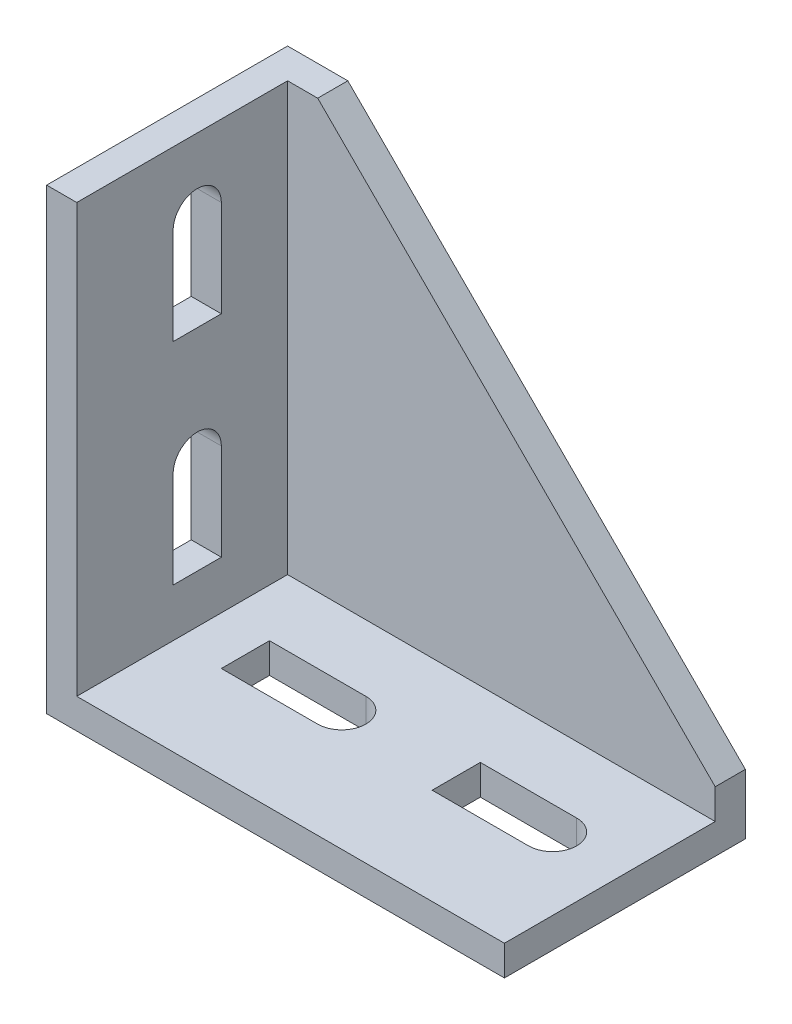
from build123d import *

# Parameters (mm, degrees)
BOSS_EXTRUDE1_DEPTH = 40
SKETCH2_W           = 71
SKETCH2_H           = 71
CUT_EXTRUDE1_DEPTH  = 35
SKETCH3_W           = 20
SKETCH3_H           = 8
CUT_EXTRUDE2_DEPTH  = 22.5
CIRPATTERN1_COUNT   = 2
CIRPATTERN1_ANGLE   = 90
FILLET1_R           = 4


with BuildPart() as part:
    # Sketch1 → Boss-Extrude1 (new body)
    with BuildSketch(Plane.XY):
        Polygon((0, 76), (0, 0), (76, 0), (76, 10), (10, 76), align=None)
    extrude(amount=BOSS_EXTRUDE1_DEPTH)

    # Sketch2 → Cut-Extrude1 (cut)
    with BuildSketch(Plane.XY.offset(40)):
        with Locations((40.5, 40.5)):
            Rectangle(SKETCH2_W, SKETCH2_H)
    extrude(amount=-CUT_EXTRUDE1_DEPTH, mode=Mode.SUBTRACT)

    # Sketch3 → Cut-Extrude2 (cut, symmetric)
    with BuildSketch(Plane(origin=(0, 5, 0), x_dir=(1, 0, 0), z_dir=(0, 1, 0))):
        with Locations((23, -20)):
            Rectangle(SKETCH3_W, SKETCH3_H)
        with Locations((58, -20)):
            Rectangle(SKETCH3_W, SKETCH3_H)
    cut_extrude2 = extrude(amount=CUT_EXTRUDE2_DEPTH, both=True, mode=Mode.SUBTRACT)

    # CirPattern1: Cut-Extrude2 ×2 about axis
    cirpattern1_axis = Axis((0, 0, 40), (0, 0, 1))
    for i in range(1, CIRPATTERN1_COUNT):
        add(cut_extrude2.rotate(cirpattern1_axis, i * CIRPATTERN1_ANGLE / (CIRPATTERN1_COUNT - 1)), mode=Mode.SUBTRACT)

    # Fillet1
    fillet1_edges = [part.edges().sort_by_distance(p)[0] for p in [
        (68, 2.5, 24),
        (68, 2.5, 16),
        (33, 2.5, 24),
        (33, 2.5, 16),
        (2.5, 33, 24),
        (2.5, 33, 16),
        (2.5, 68, 24),
        (2.5, 68, 16),
    ]]
    fillet(fillet1_edges, radius=FILLET1_R - 0.0001)  # a hair under: the kernel refuses the full size


solid = part.part
